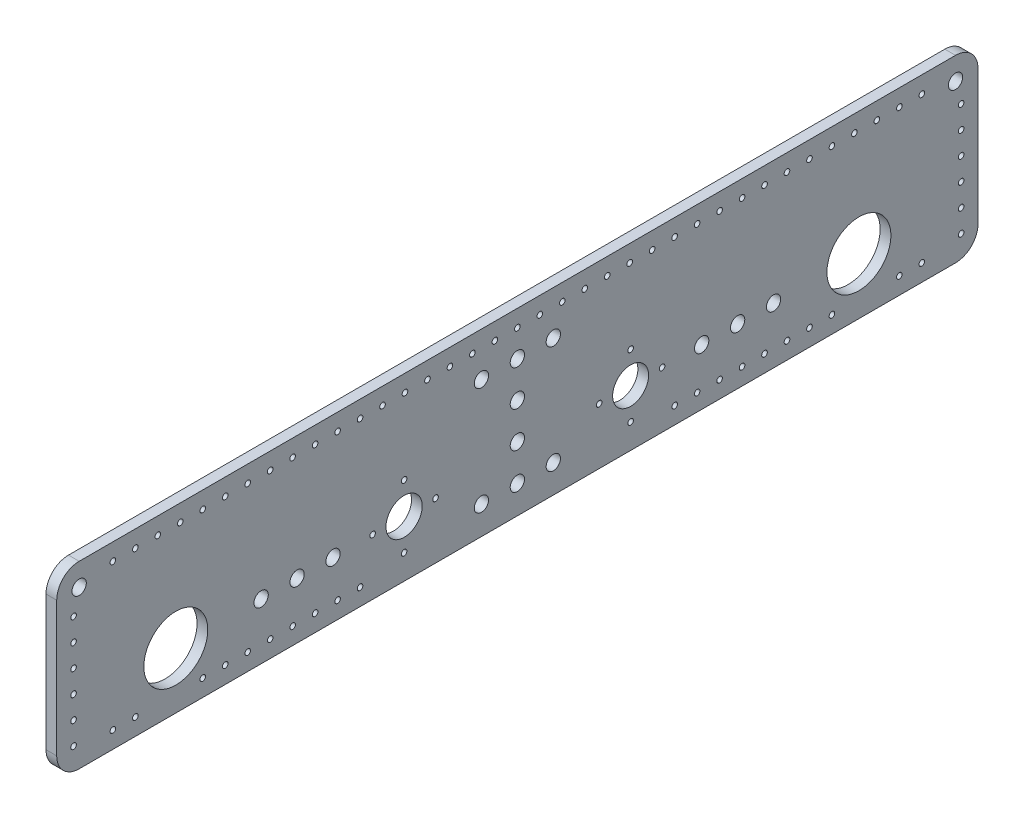
from build123d import *

# Parameters (mm, degrees)
SKETCH2_R           = 14.225
SKETCH2_R_2         = 3.18
SKETCH2_R_3         = 1.25
SKETCH2_R_4         = 8
SKETCH2_R_5         = 8.068284678
BOSS_EXTRUDE1_DEPTH = 4.7625


with BuildPart() as part:
    # Sketch2 → Boss-Extrude1 (new body)
    with BuildSketch(Plane(origin=(0, 0, 0), x_dir=(0, 0, -1), z_dir=(1, 0, 0))):
        with BuildLine():
            Line((-23.472321429, 28.668303571), (-23.472321429, -31.331696429))
            ThreePointArc((-23.472321429, -31.331696429), (-20.54338924, -38.40276424), (-13.472321429, -41.331696429))
            Line((-13.472321429, -41.331696429), (376.527678571, -41.331696429))
            ThreePointArc((376.527678571, -41.331696429), (383.598746383, -38.40276424), (386.527678571, -31.331696429))
            Line((386.527678571, -31.331696429), (386.527678571, 28.668303571))
            ThreePointArc((386.527678571, 28.668303571), (383.598746383, 35.739371383), (376.527678571, 38.668303571))
            Line((376.527678571, 38.668303571), (-13.472321429, 38.668303571))
            ThreePointArc((-13.472321429, 38.668303571), (-20.54338924, 35.739371383), (-23.472321429, 28.668303571))
        make_face()
        with Locations((29.527678571, -16.331696429)):
            Circle(SKETCH2_R, mode=Mode.SUBTRACT)
        with Locations((333.527678571, -16.331696429)):
            Circle(SKETCH2_R, mode=Mode.SUBTRACT)
        with Locations((181.527678571, -28.771696429)):
            Circle(SKETCH2_R_2, mode=Mode.SUBTRACT)
        with Locations((197.527678571, -28.771696429)):
            Circle(SKETCH2_R_2, mode=Mode.SUBTRACT)
        with Locations((197.527678571, 19.228303571)):
            Circle(SKETCH2_R_2, mode=Mode.SUBTRACT)
        with Locations((181.527678571, -12.771696429)):
            Circle(SKETCH2_R_2, mode=Mode.SUBTRACT)
        with Locations((181.527678571, 3.228303571)):
            Circle(SKETCH2_R_2, mode=Mode.SUBTRACT)
        with Locations((181.527678571, 19.228303571)):
            Circle(SKETCH2_R_2, mode=Mode.SUBTRACT)
        with Locations((165.527678571, -28.771696429)):
            Circle(SKETCH2_R_2, mode=Mode.SUBTRACT)
        with Locations((165.527678571, 19.228303571)):
            Circle(SKETCH2_R_2, mode=Mode.SUBTRACT)
        with Locations((83.502678571, -16.331696429)):
            Circle(SKETCH2_R_2, mode=Mode.SUBTRACT)
        with Locations((279.552678571, -16.331696429)):
            Circle(SKETCH2_R_2, mode=Mode.SUBTRACT)
        with Locations((1.527678571, 31.168303571)):
            Circle(SKETCH2_R_3, mode=Mode.SUBTRACT)
        with Locations((11.527678571, 31.168303571)):
            Circle(SKETCH2_R_3, mode=Mode.SUBTRACT)
        with Locations((21.527678571, 31.168303571)):
            Circle(SKETCH2_R_3, mode=Mode.SUBTRACT)
        with Locations((31.527678571, 31.168303571)):
            Circle(SKETCH2_R_3, mode=Mode.SUBTRACT)
        with Locations((41.527678571, 31.168303571)):
            Circle(SKETCH2_R_3, mode=Mode.SUBTRACT)
        with Locations((51.527678571, 31.168303571)):
            Circle(SKETCH2_R_3, mode=Mode.SUBTRACT)
        with Locations((61.527678571, 31.168303571)):
            Circle(SKETCH2_R_3, mode=Mode.SUBTRACT)
        with Locations((71.527678571, 31.168303571)):
            Circle(SKETCH2_R_3, mode=Mode.SUBTRACT)
        with Locations((81.527678571, 31.168303571)):
            Circle(SKETCH2_R_3, mode=Mode.SUBTRACT)
        with Locations((91.527678571, 31.168303571)):
            Circle(SKETCH2_R_3, mode=Mode.SUBTRACT)
        with Locations((101.527678571, 31.168303571)):
            Circle(SKETCH2_R_3, mode=Mode.SUBTRACT)
        with Locations((111.527678571, 31.168303571)):
            Circle(SKETCH2_R_3, mode=Mode.SUBTRACT)
        with Locations((121.527678571, 31.168303571)):
            Circle(SKETCH2_R_3, mode=Mode.SUBTRACT)
        with Locations((131.527678571, 31.168303571)):
            Circle(SKETCH2_R_3, mode=Mode.SUBTRACT)
        with Locations((141.527678571, 31.168303571)):
            Circle(SKETCH2_R_3, mode=Mode.SUBTRACT)
        with Locations((151.527678571, 31.168303571)):
            Circle(SKETCH2_R_3, mode=Mode.SUBTRACT)
        with Locations((161.527678571, 31.168303571)):
            Circle(SKETCH2_R_3, mode=Mode.SUBTRACT)
        with Locations((171.527678571, 31.168303571)):
            Circle(SKETCH2_R_3, mode=Mode.SUBTRACT)
        with Locations((181.527678571, 31.168303571)):
            Circle(SKETCH2_R_3, mode=Mode.SUBTRACT)
        with Locations((191.527678571, 31.168303571)):
            Circle(SKETCH2_R_3, mode=Mode.SUBTRACT)
        with Locations((201.527678571, 31.168303571)):
            Circle(SKETCH2_R_3, mode=Mode.SUBTRACT)
        with Locations((211.527678571, 31.168303571)):
            Circle(SKETCH2_R_3, mode=Mode.SUBTRACT)
        with Locations((221.527678571, 31.168303571)):
            Circle(SKETCH2_R_3, mode=Mode.SUBTRACT)
        with Locations((231.527678571, 31.168303571)):
            Circle(SKETCH2_R_3, mode=Mode.SUBTRACT)
        with Locations((241.527678571, 31.168303571)):
            Circle(SKETCH2_R_3, mode=Mode.SUBTRACT)
        with Locations((251.527678571, 31.168303571)):
            Circle(SKETCH2_R_3, mode=Mode.SUBTRACT)
        with Locations((261.527678571, 31.168303571)):
            Circle(SKETCH2_R_3, mode=Mode.SUBTRACT)
        with Locations((271.527678571, 31.168303571)):
            Circle(SKETCH2_R_3, mode=Mode.SUBTRACT)
        with Locations((281.527678571, 31.168303571)):
            Circle(SKETCH2_R_3, mode=Mode.SUBTRACT)
        with Locations((291.527678571, 31.168303571)):
            Circle(SKETCH2_R_3, mode=Mode.SUBTRACT)
        with Locations((301.527678571, 31.168303571)):
            Circle(SKETCH2_R_3, mode=Mode.SUBTRACT)
        with Locations((311.527678571, 31.168303571)):
            Circle(SKETCH2_R_3, mode=Mode.SUBTRACT)
        with Locations((321.527678571, 31.168303571)):
            Circle(SKETCH2_R_3, mode=Mode.SUBTRACT)
        with Locations((331.527678571, 31.168303571)):
            Circle(SKETCH2_R_3, mode=Mode.SUBTRACT)
        with Locations((341.527678571, 31.168303571)):
            Circle(SKETCH2_R_3, mode=Mode.SUBTRACT)
        with Locations((351.527678571, 31.168303571)):
            Circle(SKETCH2_R_3, mode=Mode.SUBTRACT)
        with Locations((361.527678571, 31.168303571)):
            Circle(SKETCH2_R_3, mode=Mode.SUBTRACT)
        with Locations((1.527678571, -33.831696429)):
            Circle(SKETCH2_R_3, mode=Mode.SUBTRACT)
        with Locations((11.527678571, -33.831696429)):
            Circle(SKETCH2_R_3, mode=Mode.SUBTRACT)
        with Locations((41.527678571, -33.831696429)):
            Circle(SKETCH2_R_3, mode=Mode.SUBTRACT)
        with Locations((51.527678571, -33.831696429)):
            Circle(SKETCH2_R_3, mode=Mode.SUBTRACT)
        with Locations((61.527678571, -33.831696429)):
            Circle(SKETCH2_R_3, mode=Mode.SUBTRACT)
        with Locations((71.527678571, -33.831696429)):
            Circle(SKETCH2_R_3, mode=Mode.SUBTRACT)
        with Locations((81.527678571, -33.831696429)):
            Circle(SKETCH2_R_3, mode=Mode.SUBTRACT)
        with Locations((91.527678571, -33.831696429)):
            Circle(SKETCH2_R_3, mode=Mode.SUBTRACT)
        with Locations((101.527678571, -33.831696429)):
            Circle(SKETCH2_R_3, mode=Mode.SUBTRACT)
        with Locations((111.527678571, -33.831696429)):
            Circle(SKETCH2_R_3, mode=Mode.SUBTRACT)
        with Locations((251.527678571, -33.831696429)):
            Circle(SKETCH2_R_3, mode=Mode.SUBTRACT)
        with Locations((261.527678571, -33.831696429)):
            Circle(SKETCH2_R_3, mode=Mode.SUBTRACT)
        with Locations((271.527678571, -33.831696429)):
            Circle(SKETCH2_R_3, mode=Mode.SUBTRACT)
        with Locations((281.527678571, -33.831696429)):
            Circle(SKETCH2_R_3, mode=Mode.SUBTRACT)
        with Locations((291.527678571, -33.831696429)):
            Circle(SKETCH2_R_3, mode=Mode.SUBTRACT)
        with Locations((301.527678571, -33.831696429)):
            Circle(SKETCH2_R_3, mode=Mode.SUBTRACT)
        with Locations((311.527678571, -33.831696429)):
            Circle(SKETCH2_R_3, mode=Mode.SUBTRACT)
        with Locations((321.527678571, -33.831696429)):
            Circle(SKETCH2_R_3, mode=Mode.SUBTRACT)
        with Locations((351.527678571, -33.831696429)):
            Circle(SKETCH2_R_3, mode=Mode.SUBTRACT)
        with Locations((361.527678571, -33.831696429)):
            Circle(SKETCH2_R_3, mode=Mode.SUBTRACT)
        with Locations((-13.472321429, 28.668303571)):
            Circle(SKETCH2_R_2, mode=Mode.SUBTRACT)
        with Locations((376.527678571, 28.668303571)):
            Circle(SKETCH2_R_2, mode=Mode.SUBTRACT)
        with Locations((99.502678571, -16.331696429)):
            Circle(SKETCH2_R_2, mode=Mode.SUBTRACT)
        with Locations((295.552678571, -16.331696429)):
            Circle(SKETCH2_R_2, mode=Mode.SUBTRACT)
        with Locations((67.502678571, -16.331696429)):
            Circle(SKETCH2_R_2, mode=Mode.SUBTRACT)
        with Locations((263.552678571, -16.331696429)):
            Circle(SKETCH2_R_2, mode=Mode.SUBTRACT)
        with Locations((131.127678571, -30.331696429)):
            Circle(SKETCH2_R_3, mode=Mode.SUBTRACT)
        with Locations((145.127678571, -16.331696429)):
            Circle(SKETCH2_R_3, mode=Mode.SUBTRACT)
        with Locations((131.127678571, -2.331696429)):
            Circle(SKETCH2_R_3, mode=Mode.SUBTRACT)
        with Locations((117.127678571, -16.331696429)):
            Circle(SKETCH2_R_3, mode=Mode.SUBTRACT)
        with Locations((231.927678571, -30.331696429)):
            Circle(SKETCH2_R_3, mode=Mode.SUBTRACT)
        with Locations((217.927678571, -16.331696429)):
            Circle(SKETCH2_R_3, mode=Mode.SUBTRACT)
        with Locations((231.927678571, -2.331696429)):
            Circle(SKETCH2_R_3, mode=Mode.SUBTRACT)
        with Locations((245.927678571, -16.331696429)):
            Circle(SKETCH2_R_3, mode=Mode.SUBTRACT)
        with Locations((231.927678571, -16.331696429)):
            Circle(SKETCH2_R_4, mode=Mode.SUBTRACT)
        with Locations((131.127678571, -16.331696429)):
            Circle(SKETCH2_R_5, mode=Mode.SUBTRACT)
        with Locations((-15.972321429, 18.668303571)):
            Circle(SKETCH2_R_3, mode=Mode.SUBTRACT)
        with Locations((379.027678571, 18.668303571)):
            Circle(SKETCH2_R_3, mode=Mode.SUBTRACT)
        with Locations((379.027678571, 8.668303571)):
            Circle(SKETCH2_R_3, mode=Mode.SUBTRACT)
        with Locations((379.027678571, -1.331696429)):
            Circle(SKETCH2_R_3, mode=Mode.SUBTRACT)
        with Locations((379.027678571, -11.331696429)):
            Circle(SKETCH2_R_3, mode=Mode.SUBTRACT)
        with Locations((379.027678571, -21.331696429)):
            Circle(SKETCH2_R_3, mode=Mode.SUBTRACT)
        with Locations((379.027678571, -31.331696429)):
            Circle(SKETCH2_R_3, mode=Mode.SUBTRACT)
        with Locations((-15.972321429, 8.668303571)):
            Circle(SKETCH2_R_3, mode=Mode.SUBTRACT)
        with Locations((-15.972321429, -1.331696429)):
            Circle(SKETCH2_R_3, mode=Mode.SUBTRACT)
        with Locations((-15.972321429, -11.331696429)):
            Circle(SKETCH2_R_3, mode=Mode.SUBTRACT)
        with Locations((-15.972321429, -21.331696429)):
            Circle(SKETCH2_R_3, mode=Mode.SUBTRACT)
        with Locations((-15.972321429, -31.331696429)):
            Circle(SKETCH2_R_3, mode=Mode.SUBTRACT)
    extrude(amount=BOSS_EXTRUDE1_DEPTH)


solid = part.part
